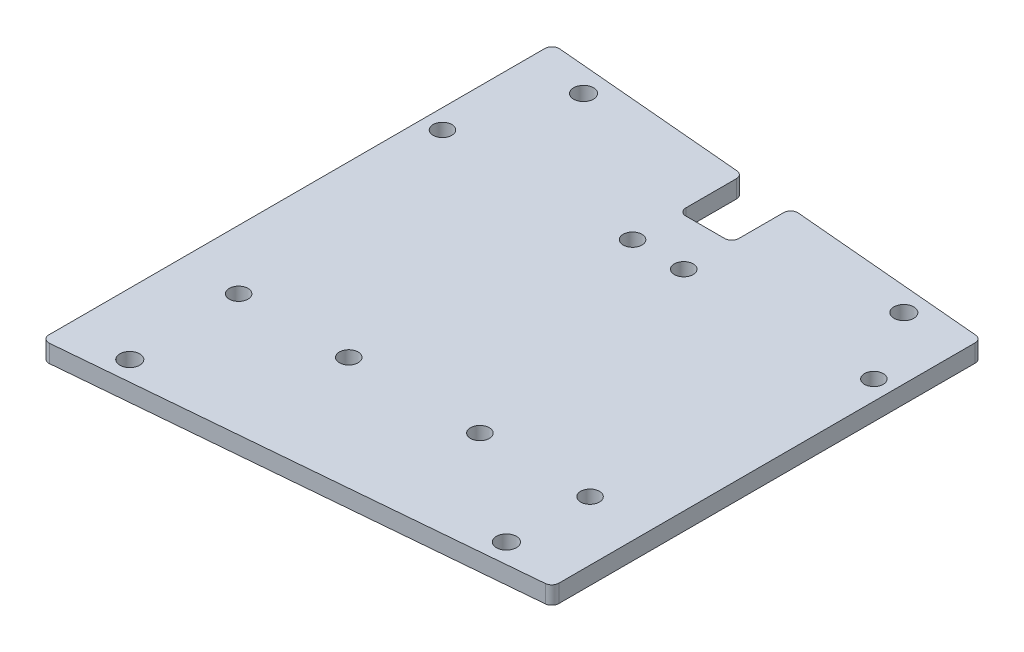
from build123d import *

# Parameters (mm, degrees)
BOSS_EXTRUDE1_DEPTH              = 6.35
SKETCH2_W                        = 19.05
SKETCH2_H                        = 44.45
CUT_EXTRUDE1_DEPTH               = 199.119607398
F_17_64_0_26563_DIAMETER_HOLE1_D = 6.747002
F_1_4_CLEARANCE_HOLE1_D          = 7.14248
SKETCH7_W                        = 3.175
SKETCH7_H                        = 184.33652634
SKETCH7_H_2                      = 154.225553014
CUT_EXTRUDE2_DEPTH               = 199.119607398
FILLET1_R                        = 2.54


with BuildPart() as part:
    # Sketch1 → Boss-Extrude1 (new body)
    with BuildSketch(Plane(origin=(0, 0, 0), x_dir=(1, 0, 0), z_dir=(0, 1, 0))):
        Polygon((0, -76.835), (0, 76.835), (-175.26, 92.16826317), (-175.26, -92.16826317), align=None)
    extrude(amount=BOSS_EXTRUDE1_DEPTH)

    # Sketch2 → Cut-Extrude1 (cut, through all)
    with BuildSketch(Plane(origin=(0, 6.35, 0), x_dir=(1, 0, 0), z_dir=(0, 1, 0))):
        with Locations((-87.63, 84.501631585)):
            Rectangle(SKETCH2_W, SKETCH2_H)
    extrude(amount=-CUT_EXTRUDE1_DEPTH, mode=Mode.SUBTRACT)

    # 17/64 (0.26563) Diameter Hole1 (through all)
    with Locations(Plane(origin=(0, 6.35, 0), x_dir=(1, 0, 0), z_dir=(0, 1, 0))):
        with Locations((-24.485, -42.27), (-64.0721, -42.27), (-111.1879, -42.27), (-150.775, -42.27), (-78.4321, 45.355), (-10.125, 45.355), (-96.8279, 45.355), (-165.135, 45.355)):
            Hole(F_17_64_0_26563_DIAMETER_HOLE1_D / 2)

    # 1/4 Clearance Hole1 (through all)
    with Locations(Plane(origin=(0, 6.35, 0), x_dir=(1, 0, 0), z_dir=(0, 1, 0))):
        with Locations((-25.4, 71.400370648), (-25.4, -71.400370648), (-149.86, -82.28920971), (-151.13, 82.042)):
            Hole(F_1_4_CLEARANCE_HOLE1_D / 2)

    # Sketch7 → Cut-Extrude2 (cut, through all)
    with BuildSketch(Plane(origin=(0, 6.35, 0), x_dir=(1, 0, 0), z_dir=(0, 1, 0))):
        with Locations((-173.6725, 0)):
            Rectangle(SKETCH7_W, SKETCH7_H)
        with Locations((-1.5875, 0)):
            Rectangle(SKETCH7_W, SKETCH7_H_2)
    extrude(amount=-CUT_EXTRUDE2_DEPTH, mode=Mode.SUBTRACT)

    # Fillet1
    fillet1_edges = [part.edges().sort_by_distance(p)[0] for p in [
        (-97.155, 3.175, -85.334961105),
        (-78.105, 3.175, -83.668302065),
        (-78.105, 3.175, -62.276631585),
        (-97.155, 3.175, -62.276631585),
        (-3.175, 3.175, -77.112776507),
        (-3.175, 3.175, 77.112776507),
        (-172.085, 3.175, 91.890486663),
        (-172.085, 3.175, -91.890486663),
    ]]
    fillet(fillet1_edges, radius=FILLET1_R)


solid = part.part
